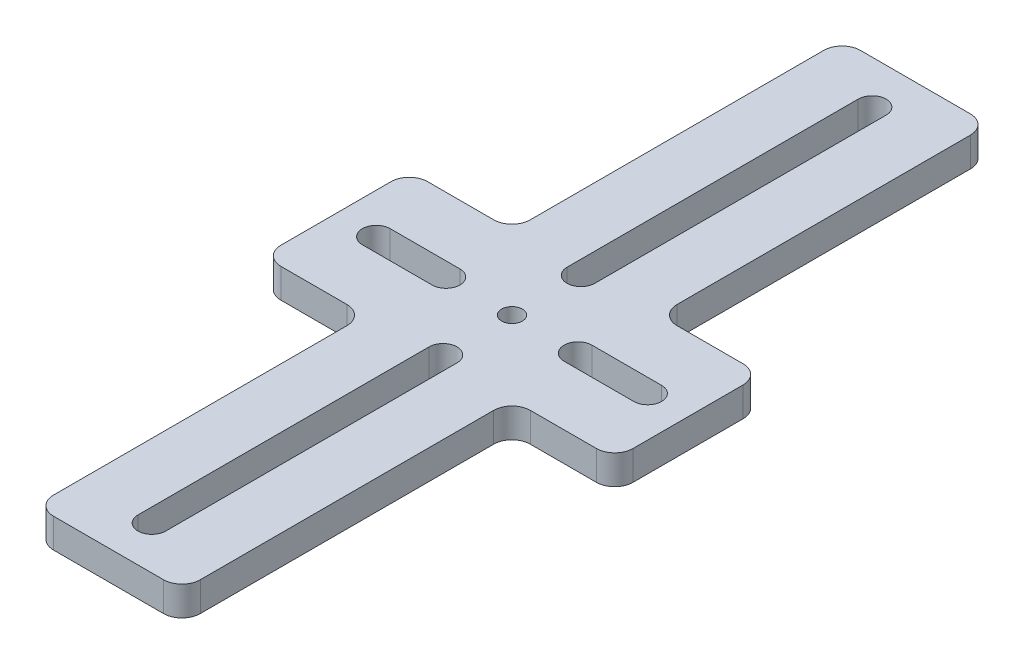
from build123d import *

# Parameters (mm, degrees)
CUT_EXTRUDE1_START = -5.08
CUT_EXTRUDE1_DEPTH = 5.08
SKETCH2_W          = 17.78
SKETCH2_H          = 57.15
CUT_EXTRUDE2_DEPTH = 77.379704765
SKETCH3_W          = 17.78
SKETCH3_H          = 57.15
CUT_EXTRUDE3_DEPTH = 77.379704765
SKETCH4_W          = 17.78
SKETCH4_H          = 57.15
CUT_EXTRUDE4_DEPTH = 77.379704765
CUT_EXTRUDE5_DEPTH = 77.379704765
CUT_EXTRUDE6_DEPTH = 77.379704765
CUT_EXTRUDE7_DEPTH = 77.379704765
CUT_EXTRUDE8_DEPTH = 77.379704765
FILLET1_R          = 3.175
SKETCH11_R         = 1.8
CUT_EXTRUDE9_DEPTH = 77.379704765


with BuildPart() as part:
    # Cut-Extrude1: read off the stored shape, not the designer's step
    # Cut-Extrude1 outline → Cut-Extrude1 (new body)
    with BuildSketch(Plane.XZ.offset(CUT_EXTRUDE1_START)):
        Polygon((-12.7, -12.7), (-12.7, -69.85), (30.48, -69.85), (30.48, 69.85), (-30.48, 69.85), (-30.48, -12.7), align=None)
    extrude(amount=CUT_EXTRUDE1_DEPTH)

    # Sketch2 → Cut-Extrude2 (cut, through all)
    with BuildSketch(Plane.XZ):
        with Locations((-21.59, 41.275)):
            Rectangle(SKETCH2_W, SKETCH2_H)
    extrude(amount=-CUT_EXTRUDE2_DEPTH, mode=Mode.SUBTRACT)

    # Sketch3 → Cut-Extrude3 (cut, through all)
    with BuildSketch(Plane.XZ):
        with Locations((21.59, 41.275)):
            Rectangle(SKETCH3_W, SKETCH3_H)
    extrude(amount=-CUT_EXTRUDE3_DEPTH, mode=Mode.SUBTRACT)

    # Sketch4 → Cut-Extrude4 (cut, through all)
    with BuildSketch(Plane.XZ):
        with Locations((21.59, -41.275)):
            Rectangle(SKETCH4_W, SKETCH4_H)
    extrude(amount=-CUT_EXTRUDE4_DEPTH, mode=Mode.SUBTRACT)

    # Sketch5 → Cut-Extrude5 (cut, through all)
    with BuildSketch(Plane(origin=(0, 5.08, 0), x_dir=(-1, 0, 0), z_dir=(0, 1, 0))):
        with BuildLine():
            Line((2.413, -62.357), (2.413, -11.938))
            ThreePointArc((2.413, -11.938), (0, -9.525), (-2.413, -11.938))
            Line((-2.413, -11.938), (-2.413, -62.357))
            ThreePointArc((-2.413, -62.357), (0, -64.77), (2.413, -62.357))
        make_face()
    extrude(amount=-CUT_EXTRUDE5_DEPTH, mode=Mode.SUBTRACT)

    # Sketch6 → Cut-Extrude6 (cut, through all)
    with BuildSketch(Plane(origin=(0, 5.08, 0), x_dir=(-1, 0, 0), z_dir=(0, 1, 0))):
        with BuildLine():
            Line((-2.413, 62.357), (-2.413, 11.938))
            ThreePointArc((-2.413, 11.938), (0, 9.525), (2.413, 11.938))
            Line((2.413, 11.938), (2.413, 62.357))
            ThreePointArc((2.413, 62.357), (0, 64.77), (-2.413, 62.357))
        make_face()
    extrude(amount=-CUT_EXTRUDE6_DEPTH, mode=Mode.SUBTRACT)

    # Sketch7 → Cut-Extrude7 (cut, through all)
    with BuildSketch(Plane(origin=(0, 5.08, 0), x_dir=(-1, 0, 0), z_dir=(0, 1, 0))):
        with BuildLine():
            Line((-23.495, -2.413), (-11.43, -2.413))
            ThreePointArc((-11.43, -2.413), (-9.017, 0), (-11.43, 2.413))
            Line((-11.43, 2.413), (-23.495, 2.413))
            ThreePointArc((-23.495, 2.413), (-25.908, 0), (-23.495, -2.413))
        make_face()
    extrude(amount=-CUT_EXTRUDE7_DEPTH, mode=Mode.SUBTRACT)

    # Sketch8 → Cut-Extrude8 (cut, through all)
    with BuildSketch(Plane.XZ):
        with BuildLine():
            Line((-23.495, -2.413), (-11.43, -2.413))
            ThreePointArc((-11.43, -2.413), (-9.017, 0), (-11.43, 2.413))
            Line((-11.43, 2.413), (-23.495, 2.413))
            ThreePointArc((-23.495, 2.413), (-25.908, 0), (-23.495, -2.413))
        make_face()
    extrude(amount=-CUT_EXTRUDE8_DEPTH, mode=Mode.SUBTRACT)

    # Fillet1
    fillet1_edges = [part.edges().sort_by_distance(p)[0] for p in [
        (-30.48, 2.54, -12.7),
        (-12.7, 2.54, -12.7),
        (-12.7, 2.54, -69.85),
        (-12.7, 2.54, 69.85),
        (-12.7, 2.54, 12.7),
        (-30.48, 2.54, 12.7),
        (12.7, 2.54, 69.85),
        (30.48, 2.54, 12.7),
        (12.7, 2.54, 12.7),
        (30.48, 2.54, -12.7),
        (12.7, 2.54, -69.85),
        (12.7, 2.54, -12.7),
    ]]
    fillet(fillet1_edges, radius=FILLET1_R)

    # Sketch11 → Cut-Extrude9 (cut, through all)
    with BuildSketch(Plane(origin=(0, 5.08, 0), x_dir=(1, 0, 0), z_dir=(0, 1, 0))):
        with Locations(Location((0, 0, 0), (0, 0, 270))):
            Circle(SKETCH11_R)
    extrude(amount=-CUT_EXTRUDE9_DEPTH, mode=Mode.SUBTRACT)


solid = part.part
